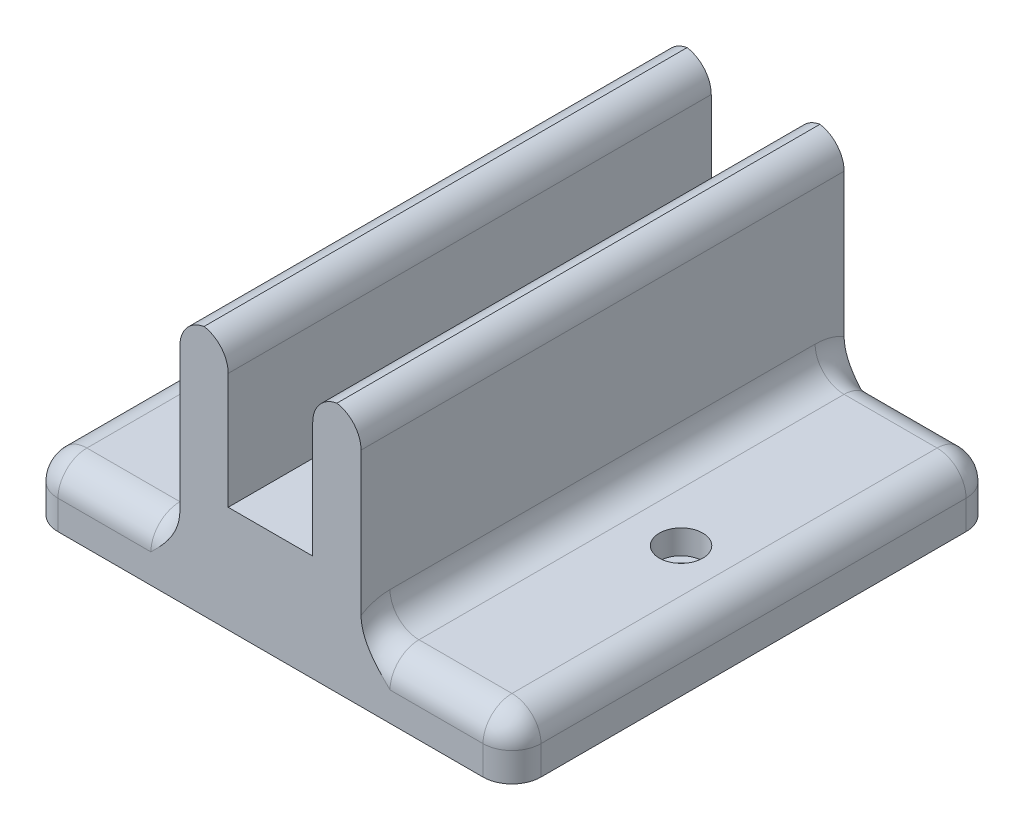
from build123d import *

# Parameters (mm, degrees)
BOSS_EXTRUDE1_DEPTH = 100
SKETCH2_W           = 100
SKETCH2_H           = 100
BOSS_EXTRUDE2_DEPTH = 12
SKETCH3_R           = 4.5
CUT_EXTRUDE1_DEPTH  = 5
SKETCH4_R           = 2.65
CUT_EXTRUDE2_DEPTH  = 7
FILLET1_R           = 6
FILLET3_R           = 6
FILLET4_R           = 6


with BuildPart() as part:
    # Sketch1 → Boss-Extrude1 (new body)
    with BuildSketch(Plane.XY):
        Polygon((0, 0), (-37.5, 0), (-37.5, 40), (-27.5, 40), (-27.5, 10), (-10, 10), (-10, 40), (0, 40), align=None)
    extrude(amount=BOSS_EXTRUDE1_DEPTH)

    # Sketch2 → Boss-Extrude2 (add)
    with BuildSketch(Plane.XZ):
        with Locations((-18.75, 50)):
            Rectangle(SKETCH2_W, SKETCH2_H)
    extrude(amount=BOSS_EXTRUDE2_DEPTH)

    # Sketch3 → Cut-Extrude1 (cut)
    with BuildSketch(Plane(origin=(0, 0, 0), x_dir=(1, 0, 0), z_dir=(0, 1, 0))):
        with Locations(Location((16.25, -50, 0), (0, 0, 180))):
            Circle(SKETCH3_R)
        with Locations(Location((-53.75, -50, 0), (0, 0, 180))):
            Circle(SKETCH3_R)
    extrude(amount=-CUT_EXTRUDE1_DEPTH, mode=Mode.SUBTRACT)

    # Sketch4 → Cut-Extrude2 (cut)
    with BuildSketch(Plane(origin=(0, -5, 0), x_dir=(1, 0, 0), z_dir=(0, 1, 0))):
        with Locations(Location((16.25, -50, 0), (0, 0, 180))):
            Circle(SKETCH4_R)
        with Locations(Location((-53.75, -50, 0), (0, 0, 180))):
            Circle(SKETCH4_R)
    extrude(amount=-CUT_EXTRUDE2_DEPTH, mode=Mode.SUBTRACT)

    # Fillet1
    # the kernel refuses this fillet: 6 mm, written as the material it takes off along each edge
    with BuildSketch(Plane(origin=(25.25, -6, 6), x_dir=(0, 1, 0), z_dir=(1, 0, 0))) as fillet1_piece_1_section:
        Polygon((0, 0), (FILLET1_R, 0), (FILLET1_R, -FILLET1_R), (0, -FILLET1_R), align=None)
    fillet1_piece_1 = extrude(amount=FILLET1_R, mode=Mode.PRIVATE)
    fillet1_piece_1 = fillet1_piece_1 - Plane(origin=(25.25, -6, 6), x_dir=(0, -0.7071067811865475, 0.7071067811865475), z_dir=(1, 0, 0)) * Sphere(FILLET1_R, mode=Mode.PRIVATE)
    add(fillet1_piece_1, mode=Mode.SUBTRACT)
    with BuildSketch(Plane(origin=(25.25, -6, 94), x_dir=(1, 0, 0), z_dir=(0, 0, 1))) as fillet1_piece_2_section:
        Polygon((0, 0), (FILLET1_R, 0), (FILLET1_R, FILLET1_R), (0, FILLET1_R), align=None)
    fillet1_piece_2 = extrude(amount=FILLET1_R, mode=Mode.PRIVATE)
    fillet1_piece_2 = fillet1_piece_2 - Plane(origin=(25.25, -6, 94), x_dir=(-0.7071067811865474, -0.7071067811865477, 0), z_dir=(0, 0, 1)) * Sphere(FILLET1_R, mode=Mode.PRIVATE)
    add(fillet1_piece_2, mode=Mode.SUBTRACT)
    with BuildSketch(Plane(origin=(-62.75, -6, 94), x_dir=(-1, 0, 0), z_dir=(0, 0, 1))) as fillet1_piece_3_section:
        Polygon((0, 0), (FILLET1_R, 0), (FILLET1_R, -FILLET1_R), (0, -FILLET1_R), align=None)
    fillet1_piece_3 = extrude(amount=FILLET1_R, mode=Mode.PRIVATE)
    fillet1_piece_3 = fillet1_piece_3 - Plane(origin=(-62.75, -6, 94), x_dir=(0.7071067811865477, -0.7071067811865474, 0), z_dir=(0, 0, 1)) * Sphere(FILLET1_R, mode=Mode.PRIVATE)
    add(fillet1_piece_3, mode=Mode.SUBTRACT)
    with BuildSketch(Plane(origin=(-62.75, -6, 6), x_dir=(0, 1, 0), z_dir=(-1, 0, 0))) as fillet1_piece_4_section:
        Polygon((0, 0), (FILLET1_R, 0), (FILLET1_R, FILLET1_R), (0, FILLET1_R), align=None)
    fillet1_piece_4 = extrude(amount=FILLET1_R, mode=Mode.PRIVATE)
    fillet1_piece_4 = fillet1_piece_4 - Plane(origin=(-62.75, -6, 6), x_dir=(0, -0.7071067811865475, 0.7071067811865475), z_dir=(-1, 0, 0)) * Sphere(FILLET1_R, mode=Mode.PRIVATE)
    add(fillet1_piece_4, mode=Mode.SUBTRACT)
    with BuildSketch(Plane(origin=(31.25, -6, 0), x_dir=(0, 0, 1), z_dir=(0, -1, 0)), Plane(origin=(31.25, -6, 100), x_dir=(-1, 0, 0), z_dir=(0, -1, 0))) as fillet1_piece_5:
        with BuildLine():
            CenterArc((FILLET1_R, FILLET1_R), FILLET1_R, 180, 90)
            Line((0, FILLET1_R), (0, 0))
            Line((0, 0), (FILLET1_R, 0))
        make_face()
    extrude(amount=21, mode=Mode.SUBTRACT)
    with BuildSketch(Plane(origin=(25.25, 0, 0), x_dir=(0, 0, 1), z_dir=(-1, 0, 0)), Plane(origin=(-37.5, 0, 0), x_dir=(0, 0, 1), z_dir=(-1, 0, 0))) as fillet1_piece_6:
        with BuildLine():
            CenterArc((FILLET1_R, -FILLET1_R), FILLET1_R, 90, 90)
            Line((0, -FILLET1_R), (0, 0))
            Line((0, 0), (FILLET1_R, 0))
        make_face()
    extrude(amount=25.25, mode=Mode.SUBTRACT)
    with BuildSketch(Plane(origin=(31.25, 0, 94), x_dir=(0, -1, 0), z_dir=(0, 0, -1)), Plane(origin=(-68.75, 0, 6), x_dir=(0, -1, 0), z_dir=(0, 0, 1))) as fillet1_piece_7:
        with BuildLine():
            CenterArc((FILLET1_R, FILLET1_R), FILLET1_R, 180, 90)
            Line((0, FILLET1_R), (0, 0))
            Line((0, 0), (FILLET1_R, 0))
        make_face()
    extrude(amount=88, mode=Mode.SUBTRACT)
    with BuildSketch(Plane(origin=(0, 0, 100), x_dir=(0, -1, 0), z_dir=(1, 0, 0)), Plane(origin=(-62.75, 0, 100), x_dir=(0, -1, 0), z_dir=(1, 0, 0))) as fillet1_piece_8:
        with BuildLine():
            CenterArc((FILLET1_R, FILLET1_R), FILLET1_R, 180, 90)
            Line((0, FILLET1_R), (0, 0))
            Line((0, 0), (FILLET1_R, 0))
        make_face()
    extrude(amount=25.25, mode=Mode.SUBTRACT)
    with BuildSketch(Plane(origin=(-68.75, -6, 100), x_dir=(1, 0, 0), z_dir=(0, -1, 0)), Plane(origin=(-68.75, -6, 0), x_dir=(0, 0, 1), z_dir=(0, -1, 0))) as fillet1_piece_9:
        with BuildLine():
            CenterArc((FILLET1_R, -FILLET1_R), FILLET1_R, 90, 90)
            Line((0, -FILLET1_R), (0, 0))
            Line((0, 0), (FILLET1_R, 0))
        make_face()
    extrude(amount=21, mode=Mode.SUBTRACT)
    with BuildSketch(Plane(origin=(-10, 40, -15), x_dir=(1, 0, 0), z_dir=(0, 0, 1)), Plane(origin=(-27.5, 40, -15), x_dir=(0, -1, 0), z_dir=(0, 0, 1)), Plane(origin=(-37.5, 40, -15), x_dir=(1, 0, 0), z_dir=(0, 0, 1)), Plane(origin=(0, 40, -15), x_dir=(0, -1, 0), z_dir=(0, 0, 1))) as fillet1_piece_10:
        with BuildLine():
            CenterArc((FILLET1_R, -FILLET1_R), FILLET1_R, 90, 90)
            Line((0, -FILLET1_R), (0, 0))
            Line((0, 0), (FILLET1_R, 0))
        make_face()
    extrude(amount=130, mode=Mode.SUBTRACT)

    # Fillet3
    fillet3_edges = [part.edges().sort_by_distance(p)[0] for p in [
        (0, 0, 50),
        (0, -1.757359313, 1.757359313),
        (0, -1.757359313, 98.242640687),
    ]]
    fillet(fillet3_edges, radius=FILLET3_R)

    # Fillet4
    # the kernel refuses this fillet: 6 mm, written as the material it adds along each edge
    with BuildSketch(Plane(origin=(-37.5, 0, 6), x_dir=(0, 1, 0), z_dir=(0, 0, 1))) as fillet4_piece_1:
        with BuildLine():
            CenterArc((FILLET4_R, FILLET4_R), FILLET4_R, 180, 90)
            Line((0, FILLET4_R), (0, 0))
            Line((0, 0), (FILLET4_R, 0))
        make_face()
    extrude(amount=88)
    with BuildSketch(Plane(origin=(-37.5, -6, 94), x_dir=(0, 1, 0), z_dir=(0, 0, -1))) as fillet4_piece_2_section:
        with BuildLine():
            CenterArc((6 + FILLET4_R, -FILLET4_R), FILLET4_R, 90, 90)
            Line((6 + FILLET4_R, 0), (6, 0))
            Line((6, 0), (6, -FILLET4_R))
        make_face()
    fillet4_piece_2 = revolve(axis=Axis((-37.5, -6, 94), (1, 0, 0)), revolution_arc=233.296989237, mode=Mode.PRIVATE)
    fillet4_piece_2 = split(fillet4_piece_2, bisect_by=Plane(origin=(-39.369769667, -1.500366283, 100), z_dir=(0, 0, -1)), keep=Keep.TOP, mode=Mode.PRIVATE)
    fillet4_piece_2 = split(fillet4_piece_2, bisect_by=Plane(origin=(-39.369769667, -12, 98.499633777), z_dir=(0, 1, 0)), keep=Keep.TOP, mode=Mode.PRIVATE)
    add(fillet4_piece_2)
    with BuildSketch(Plane(origin=(-37.5, -6, 6), x_dir=(0, 1, 0), z_dir=(0, 0, 1))) as fillet4_piece_3_section:
        with BuildLine():
            CenterArc((6 + FILLET4_R, FILLET4_R), FILLET4_R, 180, 90)
            Line((6, FILLET4_R), (6, 0))
            Line((6, 0), (6 + FILLET4_R, 0))
        make_face()
    fillet4_piece_3 = revolve(axis=Axis((-37.5, -6, 6), (-1, 0, 0)), revolution_arc=233.296989237, mode=Mode.PRIVATE)
    fillet4_piece_3 = split(fillet4_piece_3, bisect_by=Plane(origin=(-38.503801185, -12, 3.658909584), z_dir=(0, 1, 0)), keep=Keep.TOP, mode=Mode.PRIVATE)
    fillet4_piece_3 = split(fillet4_piece_3, bisect_by=Plane(origin=(-38.503801185, 1.318651502, 0), z_dir=(0, 0, 1)), keep=Keep.TOP, mode=Mode.PRIVATE)
    add(fillet4_piece_3)


solid = part.part
